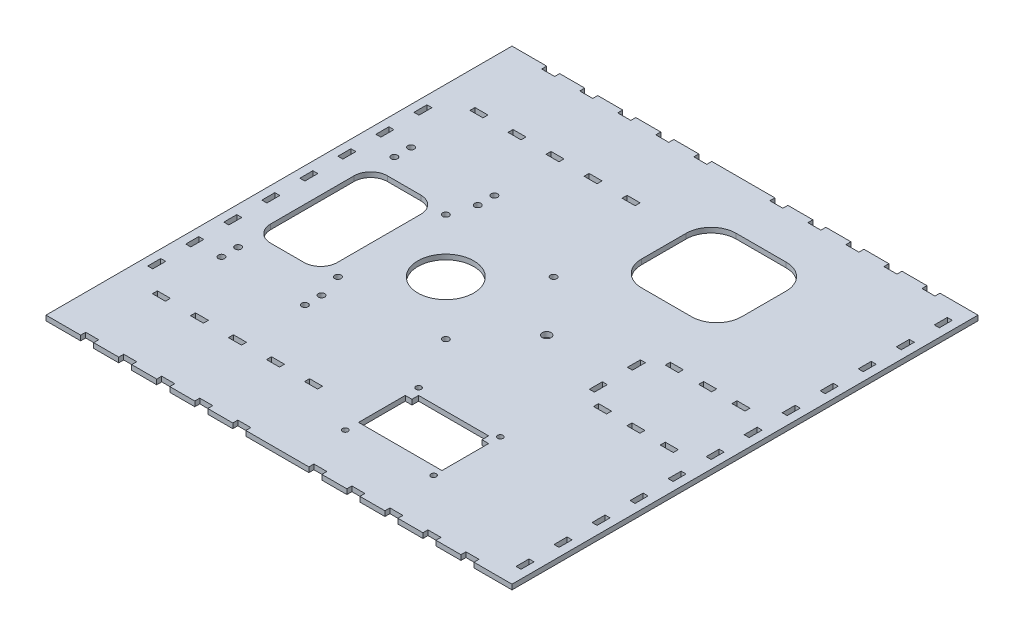
from build123d import *

# Parameters (mm, degrees)
SKETCH1_W                = 279.4
SKETCH1_H                = 279.4
BOSS_EXTRUDE1_DEPTH      = 3
SKETCH3_W                = 3
SKETCH3_H                = 7.8
CUT_EXTRUDE2_DEPTH       = 198.588410591
LPATTERN1_COUNT          = 12
LPATTERN1_PITCH          = 22.8
SKETCH5_W                = 7.8
SKETCH5_H                = 3
CUT_EXTRUDE3_DEPTH       = 198.588410591
LPATTERN2_COUNT          = 11
LPATTERN2_PITCH          = 22.8
MIRROR2_COPY_1_SKETCH_W  = 7.8
MIRROR2_COPY_1_SKETCH_H  = 3
MIRROR2_COPY_1_DEPTH     = 198.588410591
MIRROR2_COPY_2_SKETCH_W  = 7.8
MIRROR2_COPY_2_SKETCH_H  = 3
MIRROR2_COPY_2_DEPTH     = 198.588410591
MIRROR2_COPY_3_SKETCH_W  = 7.8
MIRROR2_COPY_3_SKETCH_H  = 3
MIRROR2_COPY_3_DEPTH     = 198.588410591
MIRROR2_COPY_4_SKETCH_W  = 7.8
MIRROR2_COPY_4_SKETCH_H  = 3
MIRROR2_COPY_4_DEPTH     = 198.588410591
MIRROR2_COPY_5_SKETCH_W  = 7.8
MIRROR2_COPY_5_SKETCH_H  = 3
MIRROR2_COPY_5_DEPTH     = 198.588410591
MIRROR2_COPY_6_SKETCH_W  = 7.8
MIRROR2_COPY_6_SKETCH_H  = 3
MIRROR2_COPY_6_DEPTH     = 198.588410591
MIRROR2_COPY_7_SKETCH_W  = 7.8
MIRROR2_COPY_7_SKETCH_H  = 3
MIRROR2_COPY_7_DEPTH     = 198.588410591
MIRROR2_COPY_8_SKETCH_W  = 7.8
MIRROR2_COPY_8_SKETCH_H  = 3
MIRROR2_COPY_8_DEPTH     = 198.588410591
MIRROR2_COPY_9_SKETCH_W  = 7.8
MIRROR2_COPY_9_SKETCH_H  = 3
MIRROR2_COPY_9_DEPTH     = 198.588410591
MIRROR2_COPY_10_SKETCH_W = 7.8
MIRROR2_COPY_10_SKETCH_H = 3
MIRROR2_COPY_10_DEPTH    = 198.588410591
SKETCH6_W                = 3
SKETCH6_H                = 7.8
CUT_EXTRUDE4_DEPTH       = 198.588410591
LPATTERN3_COUNT          = 8
LPATTERN3_PITCH          = 22.8
SKETCH7_R                = 16.75
CUT_EXTRUDE5_DEPTH       = 198.588410591
F_6_CLEARANCE_HOLE1_D    = 3.7973
F_6_CLEARANCE_HOLE2_D    = 3.7973
SKETCH14_R               = 2.65
CUT_EXTRUDE6_DEPTH       = 198.588410591
SKETCH16_W               = 7.8
SKETCH16_H               = 3
CUT_EXTRUDE8_DEPTH       = 198.588410591
LPATTERN5_COUNT          = 5
LPATTERN5_PITCH          = 22.8
MIRROR4_COPY_1_SKETCH_W  = 7.8
MIRROR4_COPY_1_SKETCH_H  = 3
MIRROR4_COPY_1_DEPTH     = 198.588410591
MIRROR4_COPY_2_SKETCH_W  = 7.8
MIRROR4_COPY_2_SKETCH_H  = 3
MIRROR4_COPY_2_DEPTH     = 198.588410591
MIRROR4_COPY_3_SKETCH_W  = 7.8
MIRROR4_COPY_3_SKETCH_H  = 3
MIRROR4_COPY_3_DEPTH     = 198.588410591
MIRROR4_COPY_4_SKETCH_W  = 7.8
MIRROR4_COPY_4_SKETCH_H  = 3
MIRROR4_COPY_4_DEPTH     = 198.588410591
MIRROR4_COPY_5_SKETCH_W  = 7.8
MIRROR4_COPY_5_SKETCH_H  = 3
MIRROR4_COPY_5_DEPTH     = 198.588410591
SKETCH17_W               = 7.8
SKETCH17_H               = 3
CUT_EXTRUDE9_DEPTH       = 198.588410591
LPATTERN6_COUNT          = 3
LPATTERN6_PITCH          = 20
SKETCH18_W               = 3
SKETCH18_H               = 7.8
CUT_EXTRUDE10_DEPTH      = 198.588410591
MIRROR5_COPY_1_SKETCH_W  = 7.8
MIRROR5_COPY_1_SKETCH_H  = 3
MIRROR5_COPY_1_DEPTH     = 198.588410591
MIRROR5_COPY_2_SKETCH_W  = 7.8
MIRROR5_COPY_2_SKETCH_H  = 3
MIRROR5_COPY_2_DEPTH     = 198.588410591
CUT_EXTRUDE11_DEPTH      = 198.588410591
F_4_CLEARANCE_HOLE1_D    = 3.2639


with BuildPart() as part:
    # Sketch1 → Boss-Extrude1 (new body)
    with BuildSketch(Plane(origin=(0, 0, 0), x_dir=(1, 0, 0), z_dir=(0, 1, 0))):
        Rectangle(SKETCH1_W, SKETCH1_H)
    extrude(amount=BOSS_EXTRUDE1_DEPTH)

    # Sketch3 → Cut-Extrude2 (cut, through all)
    with BuildSketch(Plane(origin=(0, 0, 0), x_dir=(-1, 0, 0), z_dir=(0, -1, 0))):
        with Locations((-133.2, 125.4)):
            Rectangle(SKETCH3_W, SKETCH3_H)
    cut_extrude2 = extrude(amount=-CUT_EXTRUDE2_DEPTH, mode=Mode.SUBTRACT)

    # LPattern1: Cut-Extrude2 ×12
    with Locations(*[(0, 0, i * LPATTERN1_PITCH) for i in range(1, LPATTERN1_COUNT)]):
        add(cut_extrude2, mode=Mode.SUBTRACT)

    # Sketch5 → Cut-Extrude3 (cut, through all)
    with BuildSketch(Plane.XZ):
        with Locations((113, -138.2)):
            Rectangle(SKETCH5_W, SKETCH5_H)
    cut_extrude3 = extrude(amount=-CUT_EXTRUDE3_DEPTH, mode=Mode.SUBTRACT)

    # LPattern2: Cut-Extrude3 ×11, 1 skipped
    with Locations(*[(-i * LPATTERN2_PITCH, 0, 0) for i in range(1, LPATTERN2_COUNT) if i not in (5,)]):
        add(cut_extrude3, mode=Mode.SUBTRACT)

    # Mirror2 copy 1 sketch → Mirror2 copy 1 (cut, through all)
    with BuildSketch(Plane(origin=(-22.8, 0, 0), x_dir=(1, 0, 0), z_dir=(0, -1, 0))):
        with Locations((113, 138.2)):
            Rectangle(MIRROR2_COPY_1_SKETCH_W, MIRROR2_COPY_1_SKETCH_H)
    extrude(amount=-MIRROR2_COPY_1_DEPTH, mode=Mode.SUBTRACT)

    # Mirror2 copy 2 sketch → Mirror2 copy 2 (cut, through all)
    with BuildSketch(Plane(origin=(-45.6, 0, 0), x_dir=(1, 0, 0), z_dir=(0, -1, 0))):
        with Locations((113, 138.2)):
            Rectangle(MIRROR2_COPY_2_SKETCH_W, MIRROR2_COPY_2_SKETCH_H)
    extrude(amount=-MIRROR2_COPY_2_DEPTH, mode=Mode.SUBTRACT)

    # Mirror2 copy 3 sketch → Mirror2 copy 3 (cut, through all)
    with BuildSketch(Plane(origin=(-68.4, 0, 0), x_dir=(1, 0, 0), z_dir=(0, -1, 0))):
        with Locations((113, 138.2)):
            Rectangle(MIRROR2_COPY_3_SKETCH_W, MIRROR2_COPY_3_SKETCH_H)
    extrude(amount=-MIRROR2_COPY_3_DEPTH, mode=Mode.SUBTRACT)

    # Mirror2 copy 4 sketch → Mirror2 copy 4 (cut, through all)
    with BuildSketch(Plane(origin=(-91.2, 0, 0), x_dir=(1, 0, 0), z_dir=(0, -1, 0))):
        with Locations((113, 138.2)):
            Rectangle(MIRROR2_COPY_4_SKETCH_W, MIRROR2_COPY_4_SKETCH_H)
    extrude(amount=-MIRROR2_COPY_4_DEPTH, mode=Mode.SUBTRACT)

    # Mirror2 copy 5 sketch → Mirror2 copy 5 (cut, through all)
    with BuildSketch(Plane(origin=(-136.8, 0, 0), x_dir=(1, 0, 0), z_dir=(0, -1, 0))):
        with Locations((113, 138.2)):
            Rectangle(MIRROR2_COPY_5_SKETCH_W, MIRROR2_COPY_5_SKETCH_H)
    extrude(amount=-MIRROR2_COPY_5_DEPTH, mode=Mode.SUBTRACT)

    # Mirror2 copy 6 sketch → Mirror2 copy 6 (cut, through all)
    with BuildSketch(Plane(origin=(-159.6, 0, 0), x_dir=(1, 0, 0), z_dir=(0, -1, 0))):
        with Locations((113, 138.2)):
            Rectangle(MIRROR2_COPY_6_SKETCH_W, MIRROR2_COPY_6_SKETCH_H)
    extrude(amount=-MIRROR2_COPY_6_DEPTH, mode=Mode.SUBTRACT)

    # Mirror2 copy 7 sketch → Mirror2 copy 7 (cut, through all)
    with BuildSketch(Plane(origin=(-182.4, 0, 0), x_dir=(1, 0, 0), z_dir=(0, -1, 0))):
        with Locations((113, 138.2)):
            Rectangle(MIRROR2_COPY_7_SKETCH_W, MIRROR2_COPY_7_SKETCH_H)
    extrude(amount=-MIRROR2_COPY_7_DEPTH, mode=Mode.SUBTRACT)

    # Mirror2 copy 8 sketch → Mirror2 copy 8 (cut, through all)
    with BuildSketch(Plane(origin=(-205.2, 0, 0), x_dir=(1, 0, 0), z_dir=(0, -1, 0))):
        with Locations((113, 138.2)):
            Rectangle(MIRROR2_COPY_8_SKETCH_W, MIRROR2_COPY_8_SKETCH_H)
    extrude(amount=-MIRROR2_COPY_8_DEPTH, mode=Mode.SUBTRACT)

    # Mirror2 copy 9 sketch → Mirror2 copy 9 (cut, through all)
    with BuildSketch(Plane(origin=(-228, 0, 0), x_dir=(1, 0, 0), z_dir=(0, -1, 0))):
        with Locations((113, 138.2)):
            Rectangle(MIRROR2_COPY_9_SKETCH_W, MIRROR2_COPY_9_SKETCH_H)
    extrude(amount=-MIRROR2_COPY_9_DEPTH, mode=Mode.SUBTRACT)

    # Mirror2 copy 10 sketch → Mirror2 copy 10 (cut, through all)
    with BuildSketch(Plane.XZ):
        with Locations((113, 138.2)):
            Rectangle(MIRROR2_COPY_10_SKETCH_W, MIRROR2_COPY_10_SKETCH_H)
    extrude(amount=-MIRROR2_COPY_10_DEPTH, mode=Mode.SUBTRACT)

    # Sketch6 → Cut-Extrude4 (cut, through all)
    with BuildSketch(Plane.XZ):
        with Locations((-133.2, -79.8)):
            Rectangle(SKETCH6_W, SKETCH6_H)
    cut_extrude4 = extrude(amount=-CUT_EXTRUDE4_DEPTH, mode=Mode.SUBTRACT)

    # LPattern3: Cut-Extrude4 ×8
    with Locations(*[(0, 0, i * LPATTERN3_PITCH) for i in range(1, LPATTERN3_COUNT)]):
        add(cut_extrude4, mode=Mode.SUBTRACT)

    # Sketch7 → Cut-Extrude5 (cut, through all)
    with BuildSketch(Plane(origin=(0, 0, 0), x_dir=(-1, 0, 0), z_dir=(0, -1, 0))):
        with Locations((39.7, 0)):
            Circle(SKETCH7_R)
    extrude(amount=-CUT_EXTRUDE5_DEPTH, mode=Mode.SUBTRACT)

    # #6 Clearance Hole1 (through all)
    with Locations(Plane(origin=(0, 3, 0), x_dir=(1, 0, 0), z_dir=(0, 1, 0))):
        with Locations((-72.025, -32.325), (-72.025, 32.325), (-7.375, 32.325), (-7.375, -32.325)):
            Hole(F_6_CLEARANCE_HOLE1_D / 2)

    # #6 Clearance Hole2 (through all)
    with Locations(Plane(origin=(0, 3, 0), x_dir=(1, 0, 0), z_dir=(0, 1, 0))):
        with Locations((-117.36, 56.83), (-67.36, 56.83), (-117.36, -56.83), (-67.36, -56.83), (-67.36, -46.83), (-117.36, -46.83), (-67.36, 46.83), (-117.36, 46.83)):
            Hole(F_6_CLEARANCE_HOLE2_D / 2)

    # Sketch14 → Cut-Extrude6 (cut, through all)
    with BuildSketch(Plane(origin=(0, 0, 0), x_dir=(-1, 0, 0), z_dir=(0, -1, 0))):
        with Locations((-20.8, 0)):
            Circle(SKETCH14_R)
    extrude(amount=-CUT_EXTRUDE6_DEPTH, mode=Mode.SUBTRACT)

    # Sketch16 → Cut-Extrude8 (cut, through all)
    with BuildSketch(Plane.XZ):
        with Locations((-115, 95.2)):
            Rectangle(SKETCH16_W, SKETCH16_H)
    cut_extrude8 = extrude(amount=-CUT_EXTRUDE8_DEPTH, mode=Mode.SUBTRACT)

    # LPattern5: Cut-Extrude8 ×5
    with Locations(*[(i * LPATTERN5_PITCH, 0, 0) for i in range(1, LPATTERN5_COUNT)]):
        add(cut_extrude8, mode=Mode.SUBTRACT)

    # Mirror4 copy 1 sketch → Mirror4 copy 1 (cut, through all)
    with BuildSketch(Plane(origin=(22.8, 0, 0), x_dir=(1, 0, 0), z_dir=(0, -1, 0))):
        with Locations((-115, -95.2)):
            Rectangle(MIRROR4_COPY_1_SKETCH_W, MIRROR4_COPY_1_SKETCH_H)
    extrude(amount=-MIRROR4_COPY_1_DEPTH, mode=Mode.SUBTRACT)

    # Mirror4 copy 2 sketch → Mirror4 copy 2 (cut, through all)
    with BuildSketch(Plane(origin=(45.6, 0, 0), x_dir=(1, 0, 0), z_dir=(0, -1, 0))):
        with Locations((-115, -95.2)):
            Rectangle(MIRROR4_COPY_2_SKETCH_W, MIRROR4_COPY_2_SKETCH_H)
    extrude(amount=-MIRROR4_COPY_2_DEPTH, mode=Mode.SUBTRACT)

    # Mirror4 copy 3 sketch → Mirror4 copy 3 (cut, through all)
    with BuildSketch(Plane(origin=(68.4, 0, 0), x_dir=(1, 0, 0), z_dir=(0, -1, 0))):
        with Locations((-115, -95.2)):
            Rectangle(MIRROR4_COPY_3_SKETCH_W, MIRROR4_COPY_3_SKETCH_H)
    extrude(amount=-MIRROR4_COPY_3_DEPTH, mode=Mode.SUBTRACT)

    # Mirror4 copy 4 sketch → Mirror4 copy 4 (cut, through all)
    with BuildSketch(Plane(origin=(91.2, 0, 0), x_dir=(1, 0, 0), z_dir=(0, -1, 0))):
        with Locations((-115, -95.2)):
            Rectangle(MIRROR4_COPY_4_SKETCH_W, MIRROR4_COPY_4_SKETCH_H)
    extrude(amount=-MIRROR4_COPY_4_DEPTH, mode=Mode.SUBTRACT)

    # Mirror4 copy 5 sketch → Mirror4 copy 5 (cut, through all)
    with BuildSketch(Plane.XZ):
        with Locations((-115, -95.2)):
            Rectangle(MIRROR4_COPY_5_SKETCH_W, MIRROR4_COPY_5_SKETCH_H)
    extrude(amount=-MIRROR4_COPY_5_DEPTH, mode=Mode.SUBTRACT)

    # Sketch17 → Cut-Extrude9 (cut, through all)
    with BuildSketch(Plane.XZ):
        with Locations((115.8, 21.5)):
            Rectangle(SKETCH17_W, SKETCH17_H)
    cut_extrude9 = extrude(amount=-CUT_EXTRUDE9_DEPTH, mode=Mode.SUBTRACT)

    # LPattern6: Cut-Extrude9 ×3
    with Locations(*[(-i * LPATTERN6_PITCH, 0, 0) for i in range(1, LPATTERN6_COUNT)]):
        add(cut_extrude9, mode=Mode.SUBTRACT)

    # Sketch18 → Cut-Extrude10 (cut, through all)
    with BuildSketch(Plane(origin=(0, 0, 0), x_dir=(-1, 0, 0), z_dir=(0, -1, 0))):
        with Locations((-63.2, -11.4)):
            Rectangle(SKETCH18_W, SKETCH18_H)
    cut_extrude10 = extrude(amount=-CUT_EXTRUDE10_DEPTH, mode=Mode.SUBTRACT)

    # Mirror5: Cut-Extrude9, Cut-Extrude10 across plane
    add(cut_extrude9.mirror(Plane.XY), mode=Mode.SUBTRACT)
    add(cut_extrude10.mirror(Plane.XY), mode=Mode.SUBTRACT)

    # Mirror5 copy 1 sketch → Mirror5 copy 1 (cut, through all)
    with BuildSketch(Plane(origin=(-20, 0, 0), x_dir=(1, 0, 0), z_dir=(0, -1, 0))):
        with Locations((115.8, -21.5)):
            Rectangle(MIRROR5_COPY_1_SKETCH_W, MIRROR5_COPY_1_SKETCH_H)
    extrude(amount=-MIRROR5_COPY_1_DEPTH, mode=Mode.SUBTRACT)

    # Mirror5 copy 2 sketch → Mirror5 copy 2 (cut, through all)
    with BuildSketch(Plane(origin=(-40, 0, 0), x_dir=(1, 0, 0), z_dir=(0, -1, 0))):
        with Locations((115.8, -21.5)):
            Rectangle(MIRROR5_COPY_2_SKETCH_W, MIRROR5_COPY_2_SKETCH_H)
    extrude(amount=-MIRROR5_COPY_2_DEPTH, mode=Mode.SUBTRACT)

    # Sketch19 → Cut-Extrude11 (cut, through all)
    with BuildSketch(Plane.XZ):
        with BuildLine():
            Line((24.7, -109.7), (54.7, -109.7))
            ThreePointArc((54.7, -109.7), (65.306601718, -105.306601718), (69.7, -94.7))
            Line((69.7, -94.7), (69.7, -68))
            ThreePointArc((69.7, -68), (65.306601718, -57.393398282), (54.7, -53))
            Line((54.7, -53), (24.7, -53))
            ThreePointArc((24.7, -53), (14.093398282, -57.393398282), (9.7, -68))
            Line((9.7, -68), (9.7, -94.7))
            ThreePointArc((9.7, -94.7), (14.093398282, -105.306601718), (24.7, -109.7))
        make_face()
        with BuildLine():
            Line((-89.7, 35), (-109.7, 35))
            ThreePointArc((-109.7, 35), (-116.771067812, 32.071067812), (-119.7, 25))
            Line((-119.7, 25), (-119.7, -25))
            ThreePointArc((-119.7, -25), (-116.771067812, -32.071067812), (-109.7, -35))
            Line((-109.7, -35), (-89.7, -35))
            ThreePointArc((-89.7, -35), (-82.628932188, -32.071067812), (-79.7, -25))
            Line((-79.7, -25), (-79.7, 25))
            ThreePointArc((-79.7, 25), (-82.628932188, 32.071067812), (-89.7, 35))
        make_face()
        Polygon((9.7, 101.7), (59.7, 101.7), (59.7, 73.7), (55.7, 73.7), (55.7, 69.7), (13.7, 69.7), (13.7, 73.7), (9.7, 73.7), align=None)
    extrude(amount=-CUT_EXTRUDE11_DEPTH, mode=Mode.SUBTRACT)

    # #4 Clearance Hole1 (through all)
    with Locations(Plane(origin=(0, 3, 0), x_dir=(1, 0, 0), z_dir=(0, 1, 0))):
        with Locations((9.7, -65.7), (59.7, -66.7), (59.7, -106.7), (9.7, -109.7)):
            Hole(F_4_CLEARANCE_HOLE1_D / 2)


solid = part.part
